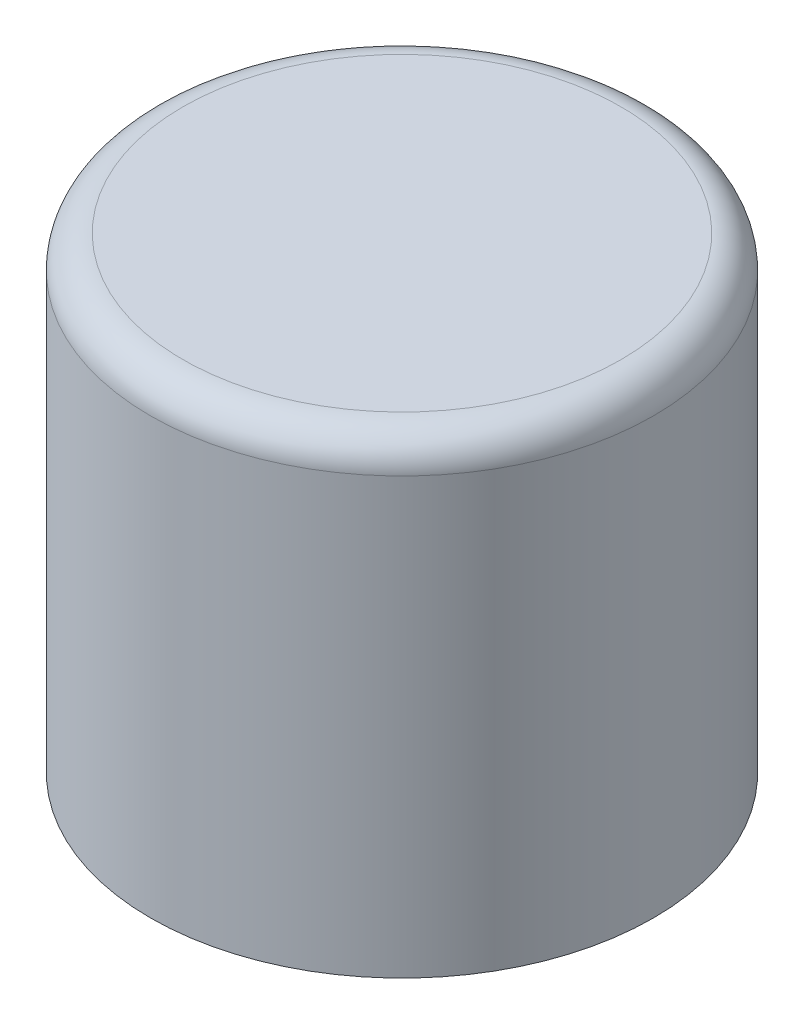
from build123d import *

# Parameters (mm, degrees)
CONG_1_R = 2


with BuildPart() as part:
    # Esquisse1 → Révolution1 (revolve)
    with BuildSketch(Plane.XY):
        Polygon((-15.5, 0), (-15.5, 28.8), (0, 28.8), (0, 25.8), (-12, 25.8), (-12, 3.2), (-14.5, 3.2), (-14.5, 2.6), (-14, 2.6), (-14, 1.6), (-14.5, 1.6), (-14.5, 1), (-14, 1), (-14, 0), align=None)
    revolve(axis=Axis((0, 0, 0), (0, 1, 0)))

    # Congé1
    cong_1_edges = [part.edges().sort_by_distance(p)[0] for p in [
        (15.5, 28.8, 0),
    ]]
    fillet(cong_1_edges, radius=CONG_1_R)


solid = part.part
